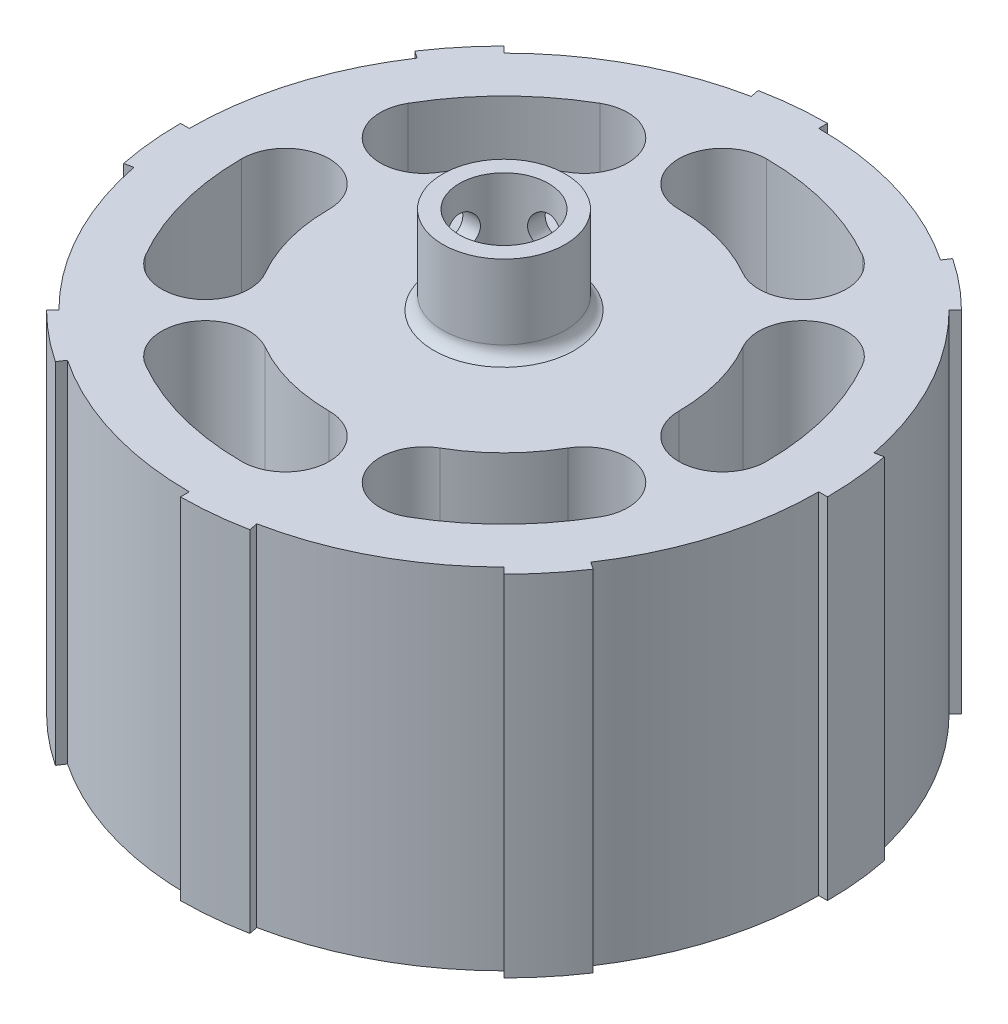
from build123d import *

# Parameters (mm, degrees)
SKETCH_1_R           = 37
EXTRUDE_1_DEPTH      = 40
SKETCH_2_R           = 5.1
CUT_EXTRUDE_1_DEPTH  = 40
CUT_EXTRUDE_2_DEPTH  = 40
SKETCH_4_R           = 7
SKETCH_4_R_2         = 5.1
EXTRUDE_2_DEPTH      = 10
CUT_EXTRUDE_3_REACH  = 74.374
CUT_EXTRUDE_4_REACH  = 74.374
CUT_EXTRUDE_7_REACH  = 74.374
EXTRUDE_START        = -40
SKETCH_14_R          = 36
EXTRUDE_4_DEPTH      = 40
CUT_EXTRUDE_11_DEPTH = 40
CUT_EXTRUDE_START    = -40
SKETCH_17_R          = 5.1
CUT_EXTRUDE_12_DEPTH = 40


with BuildPart() as part:
    # 草图1 → 凸台-拉伸1 (new body)
    with BuildSketch(Plane(origin=(0, 0, 0), x_dir=(1, 0, 0), z_dir=(0, 1, 0))):
        Circle(SKETCH_1_R)
    extrude(amount=EXTRUDE_1_DEPTH)

    # 草图2 → 切除-拉伸1 (cut)
    with BuildSketch(Plane(origin=(0, 40, 0), x_dir=(1, 0, 0), z_dir=(0, 1, 0))):
        Circle(SKETCH_2_R)
    extrude(amount=-CUT_EXTRUDE_1_DEPTH, mode=Mode.SUBTRACT)

    # 草图3 → 切除-拉伸2 (cut)
    with BuildSketch(Plane(origin=(0, 40, 0), x_dir=(1, 0, 0), z_dir=(0, 1, 0))):
        with BuildLine():
            ThreePointArc((21.650635067, -12.500000048), (23.480762153, -19.330127042), (30.31088915, -17.499999969))
            ThreePointArc((30.31088915, -17.499999969), (35, 0), (30.31088915, 17.499999969))
            ThreePointArc((30.31088915, 17.499999969), (23.48076214, 19.330127034), (21.650635082, 12.500000023))
            ThreePointArc((21.650635082, 12.500000023), (25, -1.5e-08), (21.650635067, -12.500000048))
        make_face()
        with BuildLine():
            ThreePointArc((-4e-09, 25), (5, 30.000000012), (-2.8e-08, 35))
            ThreePointArc((-2.8e-08, 35), (-17.500000023, 30.310889119), (-30.310889145, 17.499999978))
            ThreePointArc((-30.310889145, 17.499999978), (-28.480762154, 10.669873005), (-21.650635155, 12.499999896))
            ThreePointArc((-21.650635155, 12.499999896), (-12.500000054, 21.650635064), (-4e-09, 25))
        make_face()
        with BuildLine():
            ThreePointArc((1.4e-07, -35), (5, -29.99999992), (-1.9e-08, -25))
            ThreePointArc((-1.9e-08, -25), (-12.499999982, -21.650635105), (-21.650635064, -12.500000053))
            ThreePointArc((-21.650635064, -12.500000053), (-28.480762025, -10.66987293), (-30.310889204, -17.499999877))
            ThreePointArc((-30.310889204, -17.499999877), (-17.500000001, -30.310889132), (1.4e-07, -35))
        make_face()
    extrude(amount=-CUT_EXTRUDE_2_DEPTH, mode=Mode.SUBTRACT)

    # 草图4 → 凸台-拉伸2 (add, symmetric)
    with BuildSketch(Plane(origin=(0, 40, 0), x_dir=(1, 0, 0), z_dir=(0, 1, 0))):
        Circle(SKETCH_4_R)
        Circle(SKETCH_4_R_2, mode=Mode.SUBTRACT)
    extrude(amount=EXTRUDE_2_DEPTH, both=True)

    # 草图6 → 切除-拉伸3 (cut, up to next)
    with BuildSketch(Plane.XY, mode=Mode.PRIVATE) as cut_extrude_3_sk1:
        with BuildLine():
            ThreePointArc((0, 47), (-1.414213562, 43.585786438), (2, 45))
            ThreePointArc((2, 45), (1.414213562, 46.414213562), (0, 47))
        make_face()
    cut_extrude_3_tool1 = extrude(cut_extrude_3_sk1.sketch, amount=-CUT_EXTRUDE_3_REACH, mode=Mode.PRIVATE) & part.part
    add(cut_extrude_3_tool1.solids().sort_by_distance((0, 45, 0))[0], mode=Mode.SUBTRACT)

    # 草图7 → 切除-拉伸4 (cut, up to next)
    with BuildSketch(Plane(origin=(0, 0, 0), x_dir=(0, 0, -1), z_dir=(1, 0, 0)), mode=Mode.PRIVATE) as cut_extrude_4_sk1:
        with BuildLine():
            ThreePointArc((0, 47), (-1.414213562, 43.585786438), (2, 45))
            ThreePointArc((2, 45), (1.414213562, 46.414213562), (0, 47))
        make_face()
    cut_extrude_4_tool1 = extrude(cut_extrude_4_sk1.sketch, amount=-CUT_EXTRUDE_4_REACH, mode=Mode.PRIVATE) & part.part
    add(cut_extrude_4_tool1.solids().sort_by_distance((0, 45, 0))[0], mode=Mode.SUBTRACT)

    # 草图10 → 切除-拉伸7 (cut, up to next)
    with BuildSketch(Plane.XZ, mode=Mode.PRIVATE) as cut_extrude_7_sk1:
        with BuildLine():
            Line((0, 36), (0, 37))
            ThreePointArc((0, 37), (-10.740533058, 35.406792422), (-20.556098622, 30.764375655))
            Line((-20.556098622, 30.764375655), (-20.000528389, 29.932906043))
            ThreePointArc((-20.000528389, 29.932906043), (-10.450248381, 34.449852086), (0, 36))
        make_face()
    cut_extrude_7_tool1 = extrude(cut_extrude_7_sk1.sketch, amount=-CUT_EXTRUDE_7_REACH, mode=Mode.PRIVATE) & part.part
    # 草图10 → 切除-拉伸7 (cut, up to next)
    with BuildSketch(Plane.XZ, mode=Mode.PRIVATE) as cut_extrude_7_sk2:
        with BuildLine():
            Line((7.218341915, 36.289055375), (7.023251593, 35.308270095))
            ThreePointArc((7.023251593, 35.308270095), (16.970282526, 31.749165517), (25.455844123, 25.455844123))
            Line((25.455844123, 25.455844123), (26.162950904, 26.162950904))
            ThreePointArc((26.162950904, 26.162950904), (17.441679263, 32.631086781), (7.218341915, 36.289055375))
        make_face()
    cut_extrude_7_tool2 = extrude(cut_extrude_7_sk2.sketch, amount=-CUT_EXTRUDE_7_REACH, mode=Mode.PRIVATE) & part.part
    # 草图10 → 切除-拉伸7 (cut, up to next)
    with BuildSketch(Plane.XZ, mode=Mode.PRIVATE) as cut_extrude_7_sk3:
        with BuildLine():
            Line((30.764375655, 20.556098622), (29.932906043, 20.000528389))
            ThreePointArc((29.932906043, 20.000528389), (34.449852086, 10.450248381), (36, 0))
            Line((36, 0), (37, 0))
            ThreePointArc((37, 0), (35.406792422, 10.740533058), (30.764375655, 20.556098622))
        make_face()
    cut_extrude_7_tool3 = extrude(cut_extrude_7_sk3.sketch, amount=-CUT_EXTRUDE_7_REACH, mode=Mode.PRIVATE) & part.part
    # 草图10 → 切除-拉伸7 (cut, up to next)
    with BuildSketch(Plane.XZ, mode=Mode.PRIVATE) as cut_extrude_7_sk4:
        with BuildLine():
            Line((36.289055375, -7.218341915), (35.308270095, -7.023251593))
            ThreePointArc((35.308270095, -7.023251593), (31.749165517, -16.970282526), (25.455844123, -25.455844123))
            Line((25.455844123, -25.455844123), (26.162950904, -26.162950904))
            ThreePointArc((26.162950904, -26.162950904), (32.631086781, -17.441679263), (36.289055375, -7.218341915))
        make_face()
    cut_extrude_7_tool4 = extrude(cut_extrude_7_sk4.sketch, amount=-CUT_EXTRUDE_7_REACH, mode=Mode.PRIVATE) & part.part
    # 草图10 → 切除-拉伸7 (cut, up to next)
    with BuildSketch(Plane.XZ, mode=Mode.PRIVATE) as cut_extrude_7_sk5:
        with BuildLine():
            Line((20.556098622, -30.764375655), (20.000528389, -29.932906043))
            ThreePointArc((20.000528389, -29.932906043), (10.450248381, -34.449852086), (0, -36))
            Line((0, -36), (0, -37))
            ThreePointArc((0, -37), (10.740533058, -35.406792422), (20.556098622, -30.764375655))
        make_face()
    cut_extrude_7_tool5 = extrude(cut_extrude_7_sk5.sketch, amount=-CUT_EXTRUDE_7_REACH, mode=Mode.PRIVATE) & part.part
    # 草图10 → 切除-拉伸7 (cut, up to next)
    with BuildSketch(Plane.XZ, mode=Mode.PRIVATE) as cut_extrude_7_sk6:
        with BuildLine():
            Line((-7.218341915, -36.289055375), (-7.023251593, -35.308270095))
            ThreePointArc((-7.023251593, -35.308270095), (-16.970282526, -31.749165517), (-25.455844123, -25.455844123))
            Line((-25.455844123, -25.455844123), (-26.162950904, -26.162950904))
            ThreePointArc((-26.162950904, -26.162950904), (-17.441679263, -32.631086781), (-7.218341915, -36.289055375))
        make_face()
    cut_extrude_7_tool6 = extrude(cut_extrude_7_sk6.sketch, amount=-CUT_EXTRUDE_7_REACH, mode=Mode.PRIVATE) & part.part
    # 草图10 → 切除-拉伸7 (cut, up to next)
    with BuildSketch(Plane.XZ, mode=Mode.PRIVATE) as cut_extrude_7_sk7:
        with BuildLine():
            Line((-30.764375655, -20.556098622), (-29.932906043, -20.000528389))
            ThreePointArc((-29.932906043, -20.000528389), (-34.449852086, -10.450248381), (-36, 0))
            Line((-36, 0), (-37, 0))
            ThreePointArc((-37, 0), (-35.406792422, -10.740533058), (-30.764375655, -20.556098622))
        make_face()
    cut_extrude_7_tool7 = extrude(cut_extrude_7_sk7.sketch, amount=-CUT_EXTRUDE_7_REACH, mode=Mode.PRIVATE) & part.part
    # 草图10 → 切除-拉伸7 (cut, up to next)
    with BuildSketch(Plane.XZ, mode=Mode.PRIVATE) as cut_extrude_7_sk8:
        with BuildLine():
            Line((-36.289055375, 7.218341915), (-35.308270095, 7.023251593))
            ThreePointArc((-35.308270095, 7.023251593), (-31.749165517, 16.970282526), (-25.455844123, 25.455844123))
            Line((-25.455844123, 25.455844123), (-26.162950904, 26.162950904))
            ThreePointArc((-26.162950904, 26.162950904), (-32.631086781, 17.441679263), (-36.289055375, 7.218341915))
        make_face()
    cut_extrude_7_tool8 = extrude(cut_extrude_7_sk8.sketch, amount=-CUT_EXTRUDE_7_REACH, mode=Mode.PRIVATE) & part.part
    add(cut_extrude_7_tool1.solids().sort_by_distance((-0.21737, 0, 36.5))[0], mode=Mode.SUBTRACT)
    add(cut_extrude_7_tool2.solids().sort_by_distance((25.653884, 0, 25.964911))[0], mode=Mode.SUBTRACT)
    add(cut_extrude_7_tool3.solids().sort_by_distance((36.5, 0, 0.21737))[0], mode=Mode.SUBTRACT)
    add(cut_extrude_7_tool4.solids().sort_by_distance((25.964911, 0, -25.653884))[0], mode=Mode.SUBTRACT)
    add(cut_extrude_7_tool5.solids().sort_by_distance((0.21737, 0, -36.5))[0], mode=Mode.SUBTRACT)
    add(cut_extrude_7_tool6.solids().sort_by_distance((-25.653884, 0, -25.964911))[0], mode=Mode.SUBTRACT)
    add(cut_extrude_7_tool7.solids().sort_by_distance((-36.5, 0, -0.21737))[0], mode=Mode.SUBTRACT)
    add(cut_extrude_7_tool8.solids().sort_by_distance((-25.964911, 0, 25.653884))[0], mode=Mode.SUBTRACT)

    # 草图14 → 凸台-拉伸4 (add)
    with BuildSketch(Plane(origin=(0, 40, 0), x_dir=(1, 0, 0), z_dir=(0, 1, 0)).offset(EXTRUDE_START)):
        Circle(SKETCH_14_R)
    extrude(amount=EXTRUDE_4_DEPTH)

    # 草图15 → 切除-拉伸11 (cut)
    with BuildSketch(Plane(origin=(0, 40, 0), x_dir=(1, 0, 0), z_dir=(0, 1, 0))):
        with BuildLine():
            ThreePointArc((20, 0), (25, -5), (30, 0))
            ThreePointArc((30, 0), (28.97777479, 7.764571347), (25.980762119, 14.99999999))
            ThreePointArc((25.980762119, 14.99999999), (19.150635111, 16.830127029), (17.320508062, 10.000000023))
            ThreePointArc((17.320508062, 10.000000023), (19.318516522, 5.176380915), (20, 0))
        make_face()
        with BuildLine():
            ThreePointArc((17.320508096, -9.999999964), (14.142135686, -14.142135561), (10.000000118, -17.320508008))
            ThreePointArc((10.000000118, -17.320508008), (8.169872923, -24.150634995), (14.999999918, -25.980762161))
            ThreePointArc((14.999999918, -25.980762161), (21.213203317, -21.213203554), (25.980761993, -15.000000208))
            ThreePointArc((25.980761993, -15.000000208), (24.150635217, -8.169873051), (17.320508096, -9.999999964))
        make_face()
        with BuildLine():
            ThreePointArc((10.0000001, 17.320508018), (16.830127018, 19.150635093), (15.000000104, 25.980762053))
            ThreePointArc((15.000000104, 25.980762053), (7.764571417, 28.977774771), (1.3e-08, 30))
            ThreePointArc((1.3e-08, 30), (-5, 24.999999982), (4.9e-08, 20))
            ThreePointArc((4.9e-08, 20), (5.176380982, 19.318516504), (10.0000001, 17.320508018))
        make_face()
        with BuildLine():
            ThreePointArc((-15.000000208, -25.980761993), (-7.764571442, -28.977774765), (5.6e-08, -30))
            ThreePointArc((5.6e-08, -30), (5, -24.999999981), (1.9e-08, -20))
            ThreePointArc((1.9e-08, -20), (-5.176380827, -19.318516546), (-9.999999881, -17.320508144))
            ThreePointArc((-9.999999881, -17.320508144), (-16.830126924, -19.150634931), (-15.000000208, -25.980761993))
        make_face()
        with BuildLine():
            ThreePointArc((-17.320508134, 9.999999899), (-14.142135725, 14.142135523), (-10.000000147, 17.320507991))
            ThreePointArc((-10.000000147, 17.320507991), (-8.169872936, 24.150635016), (-14.99999999, 25.980762119))
            ThreePointArc((-14.99999999, 25.980762119), (-21.213203332, 21.213203539), (-25.980761973, 15.000000244))
            ThreePointArc((-25.980761973, 15.000000244), (-24.150635267, 8.169873081), (-17.320508134, 9.999999899))
        make_face()
        with BuildLine():
            ThreePointArc((-30, -8.8e-08), (-28.97777479, -7.76457135), (-25.980762161, -14.999999918))
            ThreePointArc((-25.980762161, -14.999999918), (-19.150635148, -16.83012705), (-17.320508061, -10.000000025))
            ThreePointArc((-17.320508061, -10.000000025), (-19.318516522, -5.176380916), (-20, 0))
            ThreePointArc((-20, 0), (-25.000000044, 5), (-30, -8.8e-08))
        make_face()
    extrude(amount=-CUT_EXTRUDE_11_DEPTH, mode=Mode.SUBTRACT)

    # 草图17 → 切除-拉伸12 (cut)
    with BuildSketch(Plane(origin=(0, 40, 0), x_dir=(1, 0, 0), z_dir=(0, 1, 0)).offset(CUT_EXTRUDE_START)):
        Circle(SKETCH_17_R)
    extrude(amount=CUT_EXTRUDE_12_DEPTH, mode=Mode.SUBTRACT)

    # 草图20 → 旋转1 (revolve)
    with BuildSketch(Plane.XY):
        with BuildLine():
            Line((-7, 40), (-7, 41.500033854))
            ThreePointArc((-7, 41.500033854), (-7.278579145, 40.593565511), (-8.018154145, 40))
            Line((-8.018154145, 40), (-7, 40))
        make_face()
    revolve(axis=Axis((0, -950, 0), (0, 1, 0)))


solid = part.part
